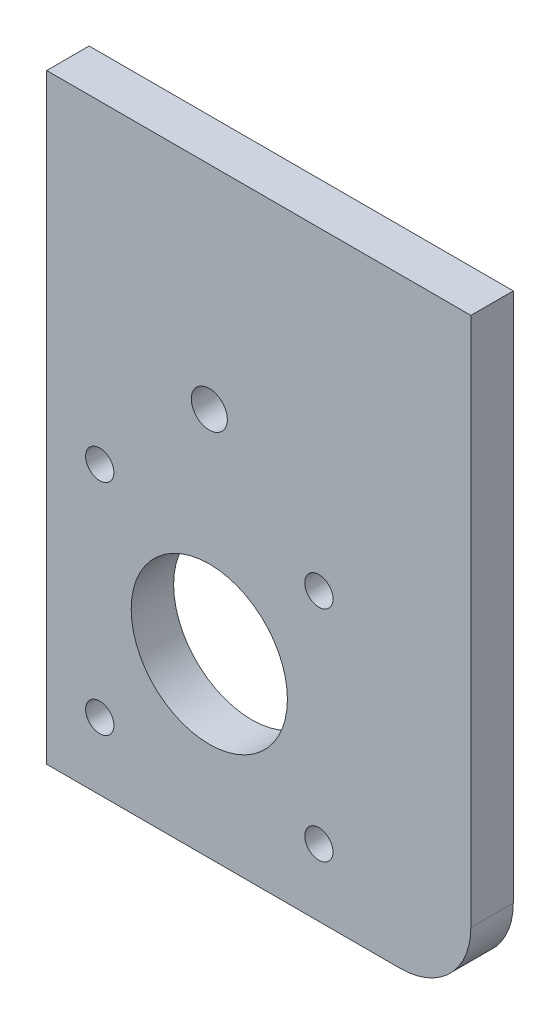
from build123d import *

# Parameters (mm, degrees)
EXTRUDE_1_DEPTH     = 6
SKETCH_2_R          = 11.05
SKETCH_2_R_2        = 2
SKETCH_2_R_3        = 2.55
CUT_EXTRUDE_1_DEPTH = 385.599022729


with BuildPart() as part:
    # Эскиз1 → Бобышка-Вытянуть1 (new body)
    with BuildSketch(Plane.XY):
        with BuildLine():
            Line((6, -293.846153846), (6, -378.846153846))
            Line((6, -378.846153846), (56, -378.846153846))
            ThreePointArc((56, -378.846153846), (63.071067812, -375.917221658), (66, -368.846153846))
            Line((66, -368.846153846), (66, -293.846153846))
            Line((66, -293.846153846), (6, -293.846153846))
        make_face()
    extrude(amount=-EXTRUDE_1_DEPTH)

    # Эскиз2 → Вырез-Вытянуть1 (cut, through all)
    with BuildSketch(Plane.XY):
        with Locations((29, -353.846153846)):
            Circle(SKETCH_2_R)
        with Locations((44.5, -369.346153846)):
            Circle(SKETCH_2_R_2)
        with Locations((13.5, -369.346153846)):
            Circle(SKETCH_2_R_2)
        with Locations((13.5, -338.346153846)):
            Circle(SKETCH_2_R_2)
        with Locations((44.5, -338.346153846)):
            Circle(SKETCH_2_R_2)
        with Locations((29, -323.846153846)):
            Circle(SKETCH_2_R_3)
    extrude(amount=-CUT_EXTRUDE_1_DEPTH, mode=Mode.SUBTRACT)


solid = part.part
